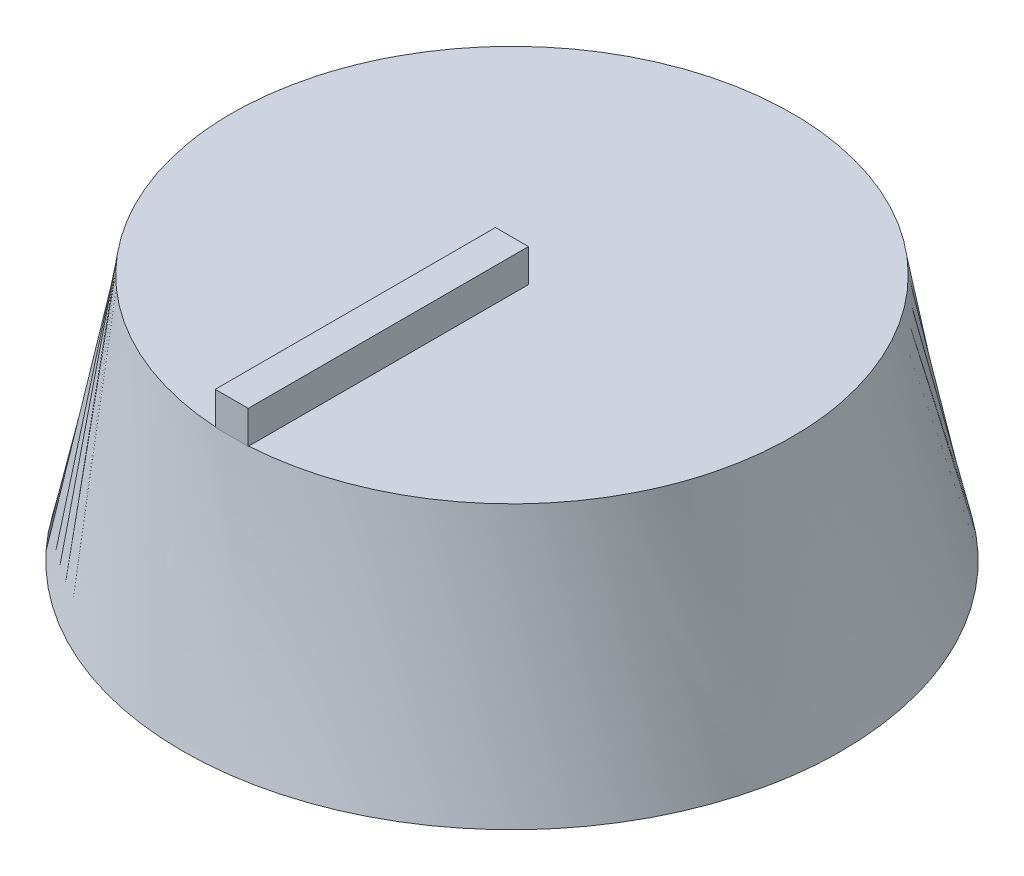
from build123d import *

# Parameters (mm, degrees)
SKETCH3_W           = 2
SKETCH3_H           = 17
EXTRUDE_THIN1_DEPTH = 2


with BuildPart() as part:
    # Loft1: read off the stored shape, not the designer's step
    # Loft1: loft between two sections, ruled curve by curve
    loft1_from = [
        Edge.make_bspline([(19.854643175, 0, -2.406895176), (15.040852823, 0, -42.116181526), (-24.668433527, 0, -37.302391174), (-19.854643175, 0, 2.406895176), (-15.040852823, 0, 42.116181526), (24.668433527, 0, 37.302391174), (19.854643175, 0, -2.406895176)], [0, 0, 0, 0, 0.5, 0.5, 0.5, 1, 1, 1, 1], 3, [1, 0.333333333, 0.333333333, 1, 0.333333333, 0.333333333, 1]),
    ]
    loft1_to = [
        Edge.make_bspline([(16.798973625, 15, 2.606623324), (22.012220272, 15, -30.991323926), (-11.585726978, 15, -36.204570573), (-16.798973625, 15, -2.606623324), (-22.012220272, 15, 30.991323926), (11.585726978, 15, 36.204570573), (16.798973625, 15, 2.606623324)], [0, 0, 0, 0, 0.5, 0.5, 0.5, 1, 1, 1, 1], 3, [1, 0.333333333, 0.333333333, 1, 0.333333333, 0.333333333, 1]),
    ]
    loft1 = Solid(Shell([*[Face.make_surface_from_curves(loft1_from[k], loft1_to[k]) for k in range(1)], Face(Wire(loft1_from)), Face(Wire(loft1_to))]))
    add(loft1)

    # Sketch3 → Extrude-Thin1 (add)
    with BuildSketch(Plane(origin=(0, 15, 0), x_dir=(1, 0, 0), z_dir=(0, 1, 0))):
        with Locations((0, -8.5)):
            Rectangle(SKETCH3_W, SKETCH3_H)
    extrude(amount=EXTRUDE_THIN1_DEPTH)


solid = part.part
